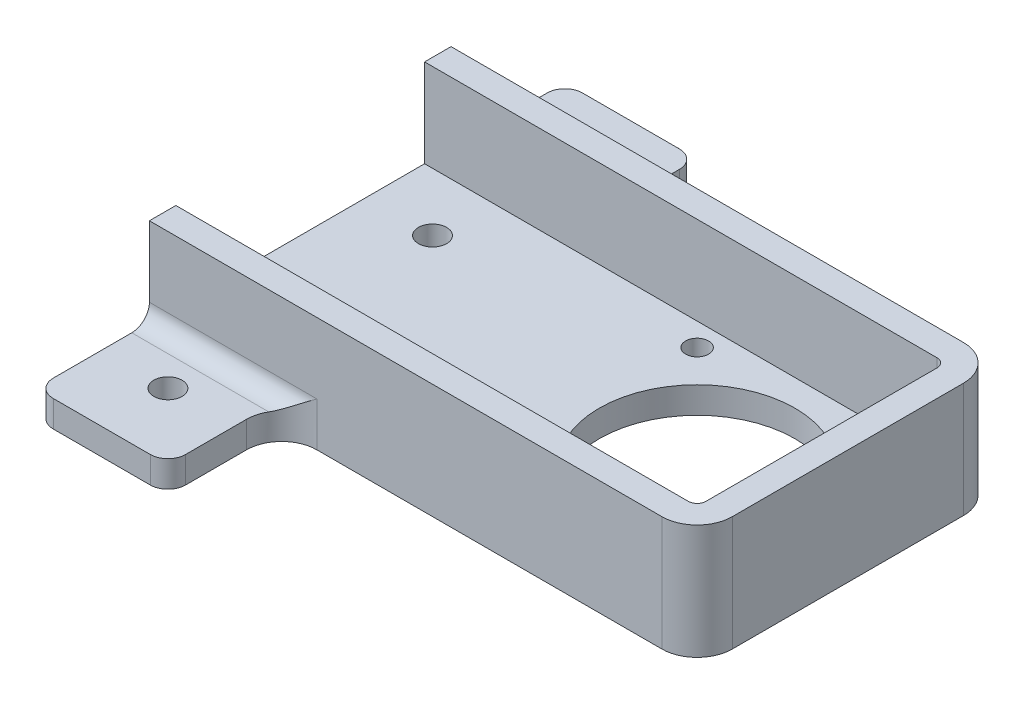
from build123d import *

# Parameters (mm, degrees)
BOSS_EXTRUDE1_DEPTH = 3
SKETCH2_R           = 1.6
CUT_EXTRUDE1_DEPTH  = 87.402604127
BOSS_EXTRUDE2_DEPTH = 10
CUT_EXTRUDE2_REACH  = 88.928
SKETCH5_R           = 11.1
CUT_EXTRUDE3_REACH  = 88.928
SKETCH6_R           = 1.3
FILLET1_R           = 1
FILLET2_R           = 4
FILLET3_R           = 4
FILLET4_R           = 2
FILLET5_R           = 2


with BuildPart() as part:
    # Sketch1 → Boss-Extrude1 (new body)
    with BuildSketch(Plane(origin=(0, 0, 0), x_dir=(1, 0, 0), z_dir=(0, 1, 0))):
        Polygon((0, 0), (15, 0), (15, 12.9), (62.1, 12.9), (62.1, 47.1), (15, 47.1), (15, 60), (0, 60), align=None)
    extrude(amount=BOSS_EXTRUDE1_DEPTH)

    # Sketch2 → Cut-Extrude1 (cut, through all)
    with BuildSketch(Plane(origin=(0, 3, 0), x_dir=(1, 0, 0), z_dir=(0, 1, 0))):
        with Locations((7.5, 52.5)):
            Circle(SKETCH2_R)
        with Locations((7.5, 37.5)):
            Circle(SKETCH2_R)
        with Locations((7.5, 7.5)):
            Circle(SKETCH2_R)
        with Locations((7.5, 22.5)):
            Circle(SKETCH2_R)
    extrude(amount=-CUT_EXTRUDE1_DEPTH, mode=Mode.SUBTRACT)

    # Sketch3 → Boss-Extrude2 (add)
    with BuildSketch(Plane(origin=(0, 3, 0), x_dir=(1, 0, 0), z_dir=(0, 1, 0))):
        Polygon((62.1, 12.9), (15, 12.9), (0, 12.9), (0, 15.9), (59.1, 15.9), (59.1, 44.1), (0, 44.1), (0, 47.1), (62.1, 47.1), align=None)
    extrude(amount=BOSS_EXTRUDE2_DEPTH)

    # Sketch5 → Cut-Extrude2 (cut, up to next)
    with BuildSketch(Plane(origin=(0, 3, 0), x_dir=(1, 0, 0), z_dir=(0, 1, 0)), mode=Mode.PRIVATE) as cut_extrude2_sk1:
        with Locations((45, 30)):
            Circle(SKETCH5_R)
    cut_extrude2_tool1 = extrude(cut_extrude2_sk1.sketch, amount=-CUT_EXTRUDE2_REACH, mode=Mode.PRIVATE) & part.part
    add(cut_extrude2_tool1.solids().sort_by_distance((45, 3, -30))[0], mode=Mode.SUBTRACT)

    # Sketch6 → Cut-Extrude3 (cut, up to next)
    with BuildSketch(Plane(origin=(0, 3, 0), x_dir=(1, 0, 0), z_dir=(0, 1, 0)), mode=Mode.PRIVATE) as cut_extrude3_sk1:
        with Locations((56.5, 41.5)):
            Circle(SKETCH6_R)
    cut_extrude3_tool1 = extrude(cut_extrude3_sk1.sketch, amount=-CUT_EXTRUDE3_REACH, mode=Mode.PRIVATE) & part.part
    # Sketch6 → Cut-Extrude3 (cut, up to next)
    with BuildSketch(Plane(origin=(0, 3, 0), x_dir=(1, 0, 0), z_dir=(0, 1, 0)), mode=Mode.PRIVATE) as cut_extrude3_sk2:
        with Locations((33.5, 41.5)):
            Circle(SKETCH6_R)
    cut_extrude3_tool2 = extrude(cut_extrude3_sk2.sketch, amount=-CUT_EXTRUDE3_REACH, mode=Mode.PRIVATE) & part.part
    # Sketch6 → Cut-Extrude3 (cut, up to next)
    with BuildSketch(Plane(origin=(0, 3, 0), x_dir=(1, 0, 0), z_dir=(0, 1, 0)), mode=Mode.PRIVATE) as cut_extrude3_sk3:
        with Locations((33.5, 18.5)):
            Circle(SKETCH6_R)
    cut_extrude3_tool3 = extrude(cut_extrude3_sk3.sketch, amount=-CUT_EXTRUDE3_REACH, mode=Mode.PRIVATE) & part.part
    # Sketch6 → Cut-Extrude3 (cut, up to next)
    with BuildSketch(Plane(origin=(0, 3, 0), x_dir=(1, 0, 0), z_dir=(0, 1, 0)), mode=Mode.PRIVATE) as cut_extrude3_sk4:
        with Locations((56.5, 18.5)):
            Circle(SKETCH6_R)
    cut_extrude3_tool4 = extrude(cut_extrude3_sk4.sketch, amount=-CUT_EXTRUDE3_REACH, mode=Mode.PRIVATE) & part.part
    add(cut_extrude3_tool1.solids().sort_by_distance((56.5, 3, -41.5))[0], mode=Mode.SUBTRACT)
    add(cut_extrude3_tool2.solids().sort_by_distance((33.5, 3, -41.5))[0], mode=Mode.SUBTRACT)
    add(cut_extrude3_tool3.solids().sort_by_distance((33.5, 3, -18.5))[0], mode=Mode.SUBTRACT)
    add(cut_extrude3_tool4.solids().sort_by_distance((56.5, 3, -18.5))[0], mode=Mode.SUBTRACT)

    # Fillet1
    fillet1_edges = [part.edges().sort_by_distance(p)[0] for p in [
        (59.1, 8, -15.9),
        (59.1, 8, -44.1),
    ]]
    fillet(fillet1_edges, radius=FILLET1_R)

    # Fillet2
    fillet2_edges = [part.edges().sort_by_distance(p)[0] for p in [
        (62.1, 6.5, -12.9),
        (62.1, 6.5, -47.1),
    ]]
    fillet(fillet2_edges, radius=FILLET2_R)

    # Fillet3
    fillet3_edges = [part.edges().sort_by_distance(p)[0] for p in [
        (15, 1.5, -47.1),
        (15, 1.5, -12.9),
    ]]
    fillet(fillet3_edges, radius=FILLET3_R)

    # Fillet4
    fillet4_edges = [part.edges().sort_by_distance(p)[0] for p in [
        (9.5, 3, -12.9),
        (9.5, 3, -47.1),
    ]]
    fillet(fillet4_edges, radius=FILLET4_R)

    # Fillet5
    fillet5_edges = [part.edges().sort_by_distance(p)[0] for p in [
        (0, 1.5, -60),
        (15, 1.5, -60),
        (0, 1.5, 0),
        (15, 1.5, 0),
    ]]
    fillet(fillet5_edges, radius=FILLET5_R)


solid = part.part
